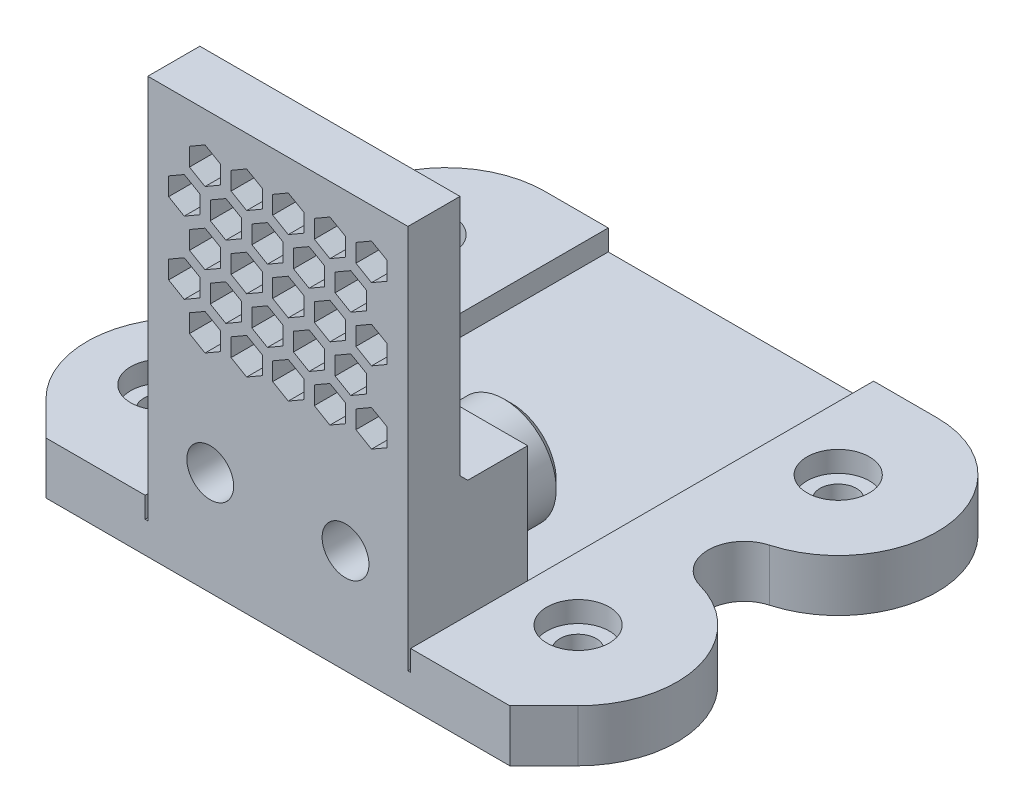
from build123d import *

# Parameters (mm, degrees)
BOSS_EXTRUDE1_DEPTH    = 25
SKETCH2_R              = 5
SKETCH2_R_2            = 2.25
BOSS_EXTRUDE2_DEPTH    = 4.5
CHAMFER1_SIZE          = 0.75
CUT_EXTRUDE1_START     = -11.5
CUT_EXTRUDE1_OUTLINE_R = 2.25
CUT_EXTRUDE1_DEPTH     = 11.5
SKETCH3_R              = 1.75
BOSS_EXTRUDE3_DEPTH    = 3
BOSS_EXTRUDE4_START    = 2
SKETCH4_R              = 3
BOSS_EXTRUDE4_DEPTH    = 2
CUT_EXTRUDE2_DEPTH     = 5


# Read off the part's stored shape, not the designer's step: Cut-Extrude1
with BuildPart() as part:
    # Sketch1 → Boss-Extrude1 (new body)
    with BuildSketch(Plane(origin=(0, 0, 0), x_dir=(0, 0, -1), z_dir=(1, 0, 0))):
        Polygon((0, 0), (0, 40), (5, 40), (5, 16.75), (5.75, 16), (11.5, 16), (11.5, 3), (44.5, 3), (44.5, 0), align=None)
    extrude(amount=-BOSS_EXTRUDE1_DEPTH)

    # Sketch2 → Boss-Extrude2 (add)
    # profile 1 of 2: a face of its own
    with BuildSketch(Plane(origin=(0, 0, -11.5), x_dir=(-1, 0, 0), z_dir=(0, 0, -1))):
        with Locations(Location((6, 10, 0), (0, 0, 90))):
            Circle(SKETCH2_R)
        with Locations(Location((6, 10, 0), (0, 0, 90))):
            Circle(SKETCH2_R_2, mode=Mode.SUBTRACT)
    # profile 2 of 2: a face of its own
    with BuildSketch(Plane(origin=(0, 0, -11.5), x_dir=(-1, 0, 0), z_dir=(0, 0, -1))):
        with Locations(Location((19, 10, 0), (0, 0, 90))):
            Circle(SKETCH2_R)
        with Locations(Location((19, 10, 0), (0, 0, 90))):
            Circle(SKETCH2_R_2, mode=Mode.SUBTRACT)
    extrude(amount=BOSS_EXTRUDE2_DEPTH)

    # Chamfer1
    chamfer1_edges = [part.edges().sort_by_distance(p)[0] for p in [
        (-6, 5, -16),
        (-19, 5, -16),
    ]]
    chamfer(chamfer1_edges, length=CHAMFER1_SIZE)

    # Cut-Extrude1 outline → Cut-Extrude1 (cut)
    with BuildSketch(Plane(origin=(0, 0, -11.5), x_dir=(-1, 0, 0), z_dir=(0, 0, -1)).offset(CUT_EXTRUDE1_START)):
        with Locations((6, 10)):
            Circle(CUT_EXTRUDE1_OUTLINE_R)
        with Locations((19, 10)):
            Circle(CUT_EXTRUDE1_OUTLINE_R)
    extrude(amount=CUT_EXTRUDE1_DEPTH, mode=Mode.SUBTRACT)

    # Sketch3 → Boss-Extrude3 (add)
    with BuildSketch(Plane(origin=(0, 3, 0), x_dir=(1, 0, 0), z_dir=(0, 1, 0))):
        with BuildLine():
            Line((0, 44.5), (6.35, 44.5))
            ThreePointArc((6.35, 44.5), (15.762886596, 36.283575445), (8.893610548, 25.846855984))
            ThreePointArc((8.893610548, 25.846855984), (6.35, 22.5), (8.893610548, 19.153144016))
            ThreePointArc((8.893610548, 19.153144016), (15.537576325, 12.416286669), (13.067514421, 3.282485579))
            Line((13.067514421, 3.282485579), (9.785028843, 0))
            Line((9.785028843, 0), (0, 0))
            Line((0, 0), (0, 11.5))
            Line((0, 11.5), (-25, 11.5))
            Line((-25, 11.5), (-25, 0))
            Line((-25, 0), (-34.785028843, 0))
            Line((-34.785028843, 0), (-38.067514421, 3.282485579))
            ThreePointArc((-38.067514421, 3.282485579), (-40.537576325, 12.416286669), (-33.893610548, 19.153144016))
            ThreePointArc((-33.893610548, 19.153144016), (-31.35, 22.5), (-33.893610548, 25.846855984))
            ThreePointArc((-33.893610548, 25.846855984), (-40.762886596, 36.283575445), (-31.35, 44.5))
            Line((-31.35, 44.5), (-25, 44.5))
            Line((-25, 44.5), (0, 44.5))
        make_face()
        with Locations(Location((6.35, 10, 0), (0, 0, 270))):
            Circle(SKETCH3_R, mode=Mode.SUBTRACT)
        with Locations(Location((6.35, 35, 0), (0, 0, 270))):
            Circle(SKETCH3_R, mode=Mode.SUBTRACT)
        with Locations(Location((-33.65, 10, 0), (0, 0, 270))):
            Circle(SKETCH3_R, mode=Mode.SUBTRACT)
        with Locations(Location((-33.65, 35, 0), (0, 0, 270))):
            Circle(SKETCH3_R, mode=Mode.SUBTRACT)
    extrude(amount=-BOSS_EXTRUDE3_DEPTH)

    # Sketch4 → Boss-Extrude4 (add)
    # profile 1 of 2: a face of its own
    with BuildSketch(Plane(origin=(0, 3, 0), x_dir=(1, 0, 0), z_dir=(0, 1, 0)).offset(BOSS_EXTRUDE4_START)):
        with BuildLine():
            Line((6.35, 44.5), (0.25, 44.5))
            Line((0.25, 44.5), (0.25, 0))
            Line((0.25, 0), (9.785028843, 0))
            Line((9.785028843, 0), (13.067514421, 3.282485579))
            ThreePointArc((13.067514421, 3.282485579), (15.537576325, 12.416286669), (8.893610548, 19.153144016))
            ThreePointArc((8.893610548, 19.153144016), (6.35, 22.5), (8.893610548, 25.846855984))
            ThreePointArc((8.893610548, 25.846855984), (15.762886596, 36.283575445), (6.35, 44.5))
        make_face()
        with Locations(Location((6.35, 10, 0), (0, 0, 270))):
            Circle(SKETCH4_R, mode=Mode.SUBTRACT)
        with Locations(Location((6.35, 35, 0), (0, 0, 270))):
            Circle(SKETCH4_R, mode=Mode.SUBTRACT)
    # profile 2 of 2: a face of its own
    with BuildSketch(Plane(origin=(0, 3, 0), x_dir=(1, 0, 0), z_dir=(0, 1, 0)).offset(BOSS_EXTRUDE4_START)):
        with BuildLine():
            Line((-38.067514421, 3.282485579), (-34.785028843, 0))
            Line((-34.785028843, 0), (-25.25, 0))
            Line((-25.25, 0), (-25.25, 44.5))
            Line((-25.25, 44.5), (-31.35, 44.5))
            ThreePointArc((-31.35, 44.5), (-40.762886596, 36.283575445), (-33.893610548, 25.846855984))
            ThreePointArc((-33.893610548, 25.846855984), (-31.35, 22.5), (-33.893610548, 19.153144016))
            ThreePointArc((-33.893610548, 19.153144016), (-40.537576325, 12.416286669), (-38.067514421, 3.282485579))
        make_face()
        with Locations(Location((-33.65, 10, 0), (0, 0, 270))):
            Circle(SKETCH4_R, mode=Mode.SUBTRACT)
        with Locations(Location((-33.65, 35, 0), (0, 0, 270))):
            Circle(SKETCH4_R, mode=Mode.SUBTRACT)
    extrude(amount=-BOSS_EXTRUDE4_DEPTH)

    # Sketch5 → Cut-Extrude2 (cut)
    with BuildSketch(Plane(origin=(0, 0, -5), x_dir=(-1, 0, 0), z_dir=(0, 0, -1))):
        Polygon((3.5, 19.714745962), (5, 20.580771366), (5, 22.312822174), (3.5, 23.178847577), (2, 22.312822174), (2, 20.580771366), align=None)
        Polygon((9, 22.312822174), (7.5, 23.178847577), (6, 22.312822174), (6, 20.580771366), (7.5, 19.714745962), (9, 20.580771366), align=None)
        Polygon((13, 22.312822174), (11.5, 23.178847577), (10, 22.312822174), (10, 20.580771366), (11.5, 19.714745962), (13, 20.580771366), align=None)
        Polygon((17, 22.312822174), (15.5, 23.178847577), (14, 22.312822174), (14, 20.580771366), (15.5, 19.714745962), (17, 20.580771366), align=None)
        Polygon((21, 22.312822174), (19.5, 23.178847577), (18, 22.312822174), (18, 20.580771366), (19.5, 19.714745962), (21, 20.580771366), align=None)
        Polygon((7, 25.776923789), (5.5, 26.642949192), (4, 25.776923789), (4, 24.044872981), (5.5, 23.178847577), (7, 24.044872981), align=None)
        Polygon((11, 25.776923789), (9.5, 26.642949192), (8, 25.776923789), (8, 24.044872981), (9.5, 23.178847577), (11, 24.044872981), align=None)
        Polygon((15, 25.776923789), (13.5, 26.642949192), (12, 25.776923789), (12, 24.044872981), (13.5, 23.178847577), (15, 24.044872981), align=None)
        Polygon((19, 25.776923789), (17.5, 26.642949192), (16, 25.776923789), (16, 24.044872981), (17.5, 23.178847577), (19, 24.044872981), align=None)
        Polygon((23, 25.776923789), (21.5, 26.642949192), (20, 25.776923789), (20, 24.044872981), (21.5, 23.178847577), (23, 24.044872981), align=None)
        Polygon((5, 29.241025404), (3.5, 30.107050808), (2, 29.241025404), (2, 27.508974596), (3.5, 26.642949192), (5, 27.508974596), align=None)
        Polygon((9, 29.241025404), (7.5, 30.107050808), (6, 29.241025404), (6, 27.508974596), (7.5, 26.642949192), (9, 27.508974596), align=None)
        Polygon((13, 29.241025404), (11.5, 30.107050808), (10, 29.241025404), (10, 27.508974596), (11.5, 26.642949192), (13, 27.508974596), align=None)
        Polygon((17, 29.241025404), (15.5, 30.107050808), (14, 29.241025404), (14, 27.508974596), (15.5, 26.642949192), (17, 27.508974596), align=None)
        Polygon((21, 29.241025404), (19.5, 30.107050808), (18, 29.241025404), (18, 27.508974596), (19.5, 26.642949192), (21, 27.508974596), align=None)
        Polygon((7, 32.705127019), (5.5, 33.571152423), (4, 32.705127019), (4, 30.973076211), (5.5, 30.107050808), (7, 30.973076211), align=None)
        Polygon((11, 32.705127019), (9.5, 33.571152423), (8, 32.705127019), (8, 30.973076211), (9.5, 30.107050808), (11, 30.973076211), align=None)
        Polygon((15, 32.705127019), (13.5, 33.571152423), (12, 32.705127019), (12, 30.973076211), (13.5, 30.107050808), (15, 30.973076211), align=None)
        Polygon((19, 32.705127019), (17.5, 33.571152423), (16, 32.705127019), (16, 30.973076211), (17.5, 30.107050808), (19, 30.973076211), align=None)
        Polygon((23, 32.705127019), (21.5, 33.571152423), (20, 32.705127019), (20, 30.973076211), (21.5, 30.107050808), (23, 30.973076211), align=None)
        Polygon((5, 36.169228634), (3.5, 37.035254038), (2, 36.169228634), (2, 34.437177826), (3.5, 33.571152423), (5, 34.437177826), align=None)
        Polygon((9, 36.169228634), (7.5, 37.035254038), (6, 36.169228634), (6, 34.437177826), (7.5, 33.571152423), (9, 34.437177826), align=None)
        Polygon((13, 36.169228634), (11.5, 37.035254038), (10, 36.169228634), (10, 34.437177826), (11.5, 33.571152423), (13, 34.437177826), align=None)
        Polygon((17, 36.169228634), (15.5, 37.035254038), (14, 36.169228634), (14, 34.437177826), (15.5, 33.571152423), (17, 34.437177826), align=None)
        Polygon((21, 36.169228634), (19.5, 37.035254038), (18, 36.169228634), (18, 34.437177826), (19.5, 33.571152423), (21, 34.437177826), align=None)
    extrude(amount=-CUT_EXTRUDE2_DEPTH, mode=Mode.SUBTRACT)


solid = part.part
